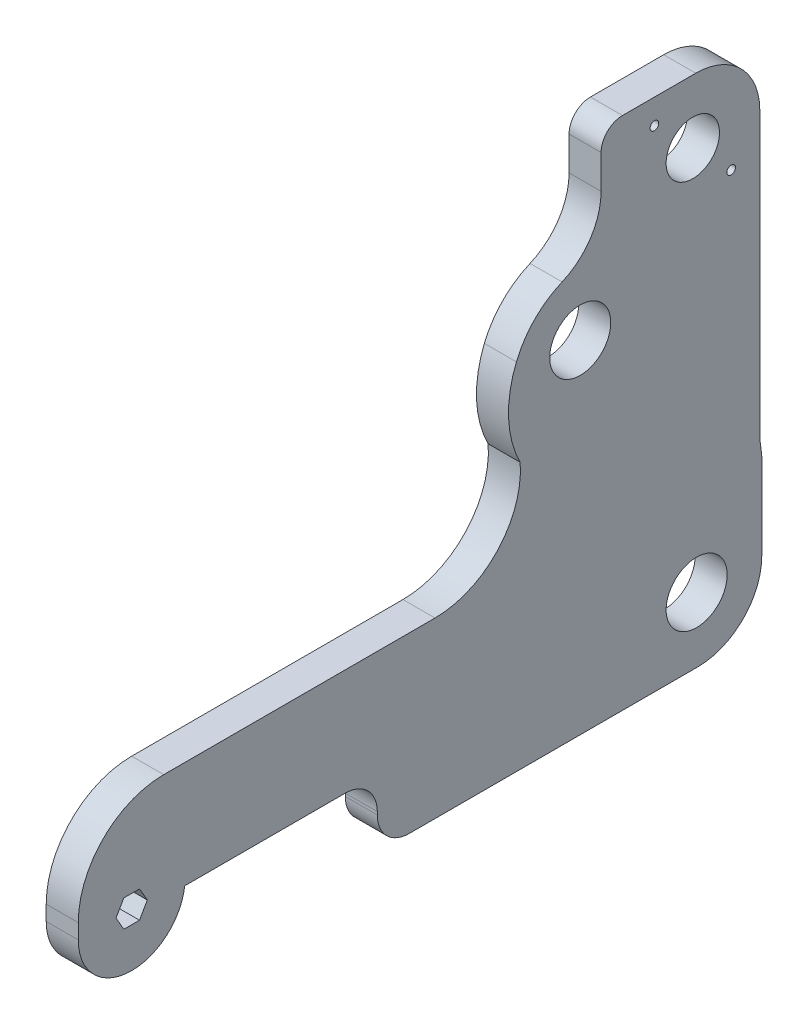
from build123d import *

# Parameters (mm, degrees)
SALIENTE_EXTRUIR1_DEPTH = 15
CORTAR_EXTRUIR1_DEPTH   = 477.91260816
REDONDEO1_R             = 220
REDONDEO2_R             = 70
REDONDEO3_R             = 15
REDONDEO4_R             = 30
CROQUIS7_R              = 14.29
CORTAR_EXTRUIR5_DEPTH   = 477.91260816
CROQUIS8_R              = 14.29
CORTAR_EXTRUIR6_DEPTH   = 523
CORTAR_EXTRUIR12_DEPTH  = 477.91260816
REDONDEO5_R             = 40
CORTAR_EXTRUIR13_DEPTH  = 429.85874997
REDONDEO6_R             = 40
SALIENTE_EXTRUIR3_DEPTH = 15
SALIENTE_EXTRUIR4_DEPTH = 15
CROQUIS21_R             = 2.02
CROQUIS21_R_2           = 12.5
CORTAR_EXTRUIR17_DEPTH  = 450.880285455
REDONDEO7_R             = 30


with BuildPart() as part:
    # Croquis1 → Saliente-Extruir1 (new body)
    with BuildSketch(Plane(origin=(0, 0, 0), x_dir=(0, 0, -1), z_dir=(1, 0, 0))):
        with BuildLine():
            Line((65, 25.4), (65, 281.06162282))
            Line((65, 281.06162282), (385, 281.06162282))
            Line((385, 281.06162282), (385, -8.93837718))
            Line((385, -8.93837718), (205, -8.93837718))
            Line((205, -8.93837718), (205, 22.4))
            Line((205, 22.4), (115, 22.4))
            Line((115, 22.4), (114.819347292, 22.4))
            ThreePointArc((114.819347292, 22.4), (88.497282844, 0.445204045), (65, 25.4))
        make_face()
    extrude(amount=SALIENTE_EXTRUIR1_DEPTH)

    # Croquis2 → Cortar-Extruir1 (cut, through all)
    with BuildSketch(Plane.ZY):
        Polygon((-82.667651581, 25.4), (-86.333825791, 31.75), (-93.666174209, 31.75), (-97.332348419, 25.4), (-93.666174209, 19.05), (-86.333825791, 19.05), align=None)
    extrude(amount=-CORTAR_EXTRUIR1_DEPTH, mode=Mode.SUBTRACT)

    # Redondeo1
    redondeo1_edges = [part.edges().sort_by_distance(p)[0] for p in [
        (7.5, 281.06162282, -385),
    ]]
    fillet(redondeo1_edges, radius=REDONDEO1_R)

    # Redondeo2
    redondeo2_edges = [part.edges().sort_by_distance(p)[0] for p in [
        (7.5, 281.06162282, -65),
    ]]
    fillet(redondeo2_edges, radius=REDONDEO2_R)

    # Redondeo3
    redondeo3_edges = [part.edges().sort_by_distance(p)[0] for p in [
        (7.5, -8.93837718, -205),
        (7.5, 22.4, -205),
    ]]
    fillet(redondeo3_edges, radius=REDONDEO3_R)

    # Redondeo4
    redondeo4_edges = [part.edges().sort_by_distance(p)[0] for p in [
        (7.5, -8.93837718, -385),
    ]]
    fillet(redondeo4_edges, radius=REDONDEO4_R)

    # Croquis7 → Cortar-Extruir5 (cut, through all)
    with BuildSketch(Plane(origin=(15, 0, 0), x_dir=(0, 0, -1), z_dir=(1, 0, 0))):
        with Locations((354.499999998, 21.561622823)):
            Circle(CROQUIS7_R)
    extrude(amount=-CORTAR_EXTRUIR5_DEPTH, mode=Mode.SUBTRACT)

    # Croquis8 → Cortar-Extruir6 (cut)
    with BuildSketch(Plane(origin=(15, 0, 0), x_dir=(0, 0, -1), z_dir=(1, 0, 0))):
        with Locations((299.999999998, 151.061622823)):
            Circle(CROQUIS8_R)
    extrude(amount=-CORTAR_EXTRUIR6_DEPTH, mode=Mode.SUBTRACT)

    # Croquis14 → Cortar-Extruir12 (cut, through all)
    with BuildSketch(Plane(origin=(15, 0, 0), x_dir=(0, 0, -1), z_dir=(1, 0, 0))):
        with BuildLine():
            Line((65, 72.4), (270, 72.4))
            ThreePointArc((270, 72.4), (274.363902477, 93.8541681), (271.886825139, 115.607077367))
            ThreePointArc((271.886825139, 115.607077367), (293.695729554, 182.870527237), (360.959179423, 161.06162282))
            Line((360.959179423, 161.06162282), (409.037931036, 257.33581614))
            Line((409.037931036, 257.33581614), (105.335360325, 302.08857435))
            Line((105.335360325, 302.08857435), (0, 212.58305793))
            Line((0, 212.58305793), (65, 72.4))
        make_face()
    extrude(amount=-CORTAR_EXTRUIR12_DEPTH, mode=Mode.SUBTRACT)

    # Redondeo5
    # the kernel refuses this fillet: 40 mm, written as the material it adds along each edge
    with BuildSketch(Plane(origin=(15, 72.4, -270), x_dir=(0, 0.9990478553762716, -0.0436277740444352), z_dir=(-1, 0, 0))) as redondeo5_piece_1:
        with BuildLine():
            CenterArc((38.304739361, -39.69334508), REDONDEO5_R, 82.900783034, 94.598735986)
            Line((-1.657174854, -37.948234118), (0, 0))
            ThreePointArc((0, 0), (21.624127981, 3.423749812), (43.248255961, 0))
        make_face()
    extrude(amount=15)
    # the kernel refuses this fillet: 40 mm, written as the material it takes off along each edge
    with BuildSketch(Plane(origin=(115, 72.4, -65), x_dir=(0, 0, -1), z_dir=(-1, 0, 0))) as redondeo5_2_piece_1:
        with BuildLine():
            CenterArc((REDONDEO5_R, REDONDEO5_R), REDONDEO5_R, 180, 90)
            Line((0, REDONDEO5_R), (0, 0))
            Line((0, 0), (REDONDEO5_R, 0))
        make_face()
    extrude(amount=215, mode=Mode.SUBTRACT)

    # Croquis15 → Cortar-Extruir13 (cut, through all)
    with BuildSketch(Plane(origin=(15, 0, 0), x_dir=(0, 0, -1), z_dir=(1, 0, 0))):
        with BuildLine():
            Line((316.423002092, 188.334350095), (358.626196651, 190.922485323))
            Line((358.626196651, 190.922485323), (422.761195779, 101.20409943))
            Line((422.761195779, 101.20409943), (385, 21.06162282))
            ThreePointArc((385, 21.06162282), (371.881027209, 113.376882145), (316.423002092, 188.334350095))
        make_face()
    extrude(amount=-CORTAR_EXTRUIR13_DEPTH, mode=Mode.SUBTRACT)

    # Redondeo6
    # the kernel refuses this fillet: 40 mm, written as the material it takes off along each edge
    with BuildSketch(Plane(origin=(154.505258901, 188.334350095, -316.423002092), x_dir=(0, -0.5580210387188341, 0.8298268014153035), z_dir=(-1, 0, 0))) as redondeo6_piece_1:
        with BuildLine():
            CenterArc((33.481262136, -33.19307214), REDONDEO6_R, 56.080950646, 115.615192876)
            ThreePointArc((-6.099380682, -27.416159984), (-3.556977801, -13.59522176), (0, 0))
            ThreePointArc((0, 0), (27.90105178, 8.508659825), (55.802103561, 0))
        make_face()
    extrude(amount=294.010517803, mode=Mode.SUBTRACT)

    # Croquis18 → Saliente-Extruir3 (add, through all)
    with BuildSketch(Plane.ZY):
        with BuildLine():
            Line((-336.783225667, 168.987268689), (-324.9259333, 170.954067241))
            Line((-324.9259333, 170.954067241), (-309.780230989, 182.020805528))
            ThreePointArc((-309.780230989, 182.020805528), (-329.588467491, 188.570394011), (-336.783225667, 168.987268689))
        make_face()
    extrude(amount=-SALIENTE_EXTRUIR3_DEPTH)

    # Croquis20 → Saliente-Extruir4 (add, through all)
    with BuildSketch(Plane.ZY):
        with BuildLine():
            Line((-384.080413654, 202.254755045), (-384.080413654, 68.806205343))
            Line((-384.080413654, 68.806205343), (-355.955719628, 128.198236155))
            Line((-355.955719628, 128.198236155), (-350.988918253, 138.686827429))
            Line((-350.988918253, 138.686827429), (-333.391481861, 167.902196457))
            Line((-333.391481861, 167.902196457), (-333.391481861, 179.145496263))
            Line((-333.391481861, 179.145496263), (-331.848601066, 185.40903393))
            Line((-331.848601066, 185.40903393), (-327.722665886, 187.904048047))
            Line((-327.722665886, 187.904048047), (-321.465563641, 187.904048047))
            Line((-321.465563641, 187.904048047), (-315.23558207, 184.151512718))
            Line((-315.23558207, 184.151512718), (-309.780230989, 182.020805528))
            Line((-309.780230989, 182.020805528), (-309.780230989, 222.254755045))
            ThreePointArc((-309.780230989, 222.254755045), (-312.709163177, 229.325822857), (-319.780230989, 232.254755045))
            Line((-319.780230989, 232.254755045), (-354.080413654, 232.254755045))
            ThreePointArc((-354.080413654, 232.254755045), (-375.293617089, 223.467958481), (-384.080413654, 202.254755045))
        make_face()
    extrude(amount=-SALIENTE_EXTRUIR4_DEPTH)

    # Croquis21 → Cortar-Extruir17 (cut, through all)
    with BuildSketch(Plane.ZY):
        with Locations((-334.74499674, 220.62921413)):
            Circle(CROQUIS21_R)
        with Locations((-370.666021225, 184.708189645)):
            Circle(CROQUIS21_R)
        with Locations((-352.705508983, 202.668701887)):
            Circle(CROQUIS21_R_2)
    extrude(amount=-CORTAR_EXTRUIR17_DEPTH, mode=Mode.SUBTRACT)

    # Redondeo7
    redondeo7_edges = [part.edges().sort_by_distance(p)[0] for p in [
        (7.5, 182.020805528, -309.780230989),
    ]]
    fillet(redondeo7_edges, radius=REDONDEO7_R)


solid = part.part
